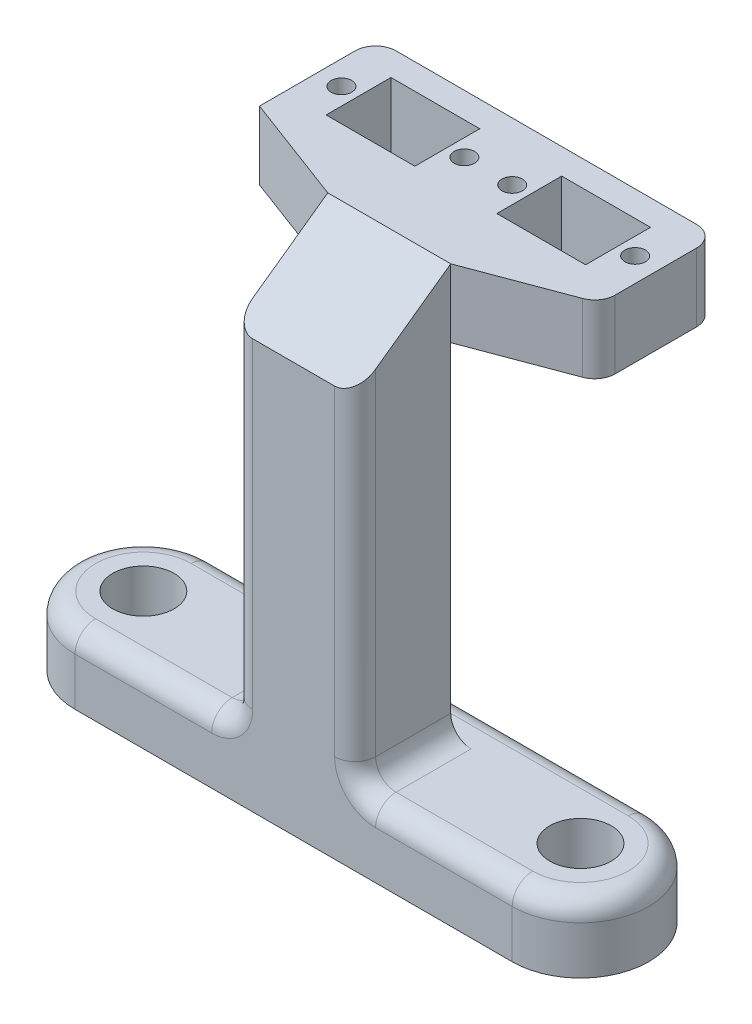
from build123d import *

# Parameters (mm, degrees)
SKETCH1_R           = 4.5
BOSS_EXTRUDE1_DEPTH = 10
SKETCH2_W           = 18
SKETCH2_H           = 14
BOSS_EXTRUDE2_DEPTH = 50
SKETCH4_R           = 1.5
SKETCH4_W           = 13
SKETCH4_H           = 9.5
BOSS_EXTRUDE3_DEPTH = 10
LOFT2_START         = -9
LOFT2_DEPTH         = 18
FILLET4_R           = 3


# Read off the part's stored shape, not the designer's step: Loft2
with BuildPart() as part:
    # Sketch1 → Boss-Extrude1 (new body)
    with BuildSketch(Plane(origin=(0, 0, 0), x_dir=(1, 0, 0), z_dir=(0, 1, 0))):
        with BuildLine():
            Line((-32, 10), (32, 10))
            ThreePointArc((32, 10), (42, 0), (32, -10))
            Line((32, -10), (-32, -10))
            ThreePointArc((-32, -10), (-42, 0), (-32, 10))
        make_face()
        with Locations(Location((-32, 0, 0), (0, 0, 270))):
            Circle(SKETCH1_R, mode=Mode.SUBTRACT)
        with Locations(Location((32, 0, 0), (0, 0, 270))):
            Circle(SKETCH1_R, mode=Mode.SUBTRACT)
    extrude(amount=BOSS_EXTRUDE1_DEPTH)

    # Sketch2 → Boss-Extrude2 (add)
    with BuildSketch(Plane(origin=(0, 10, 0), x_dir=(1, 0, 0), z_dir=(0, 1, 0))):
        with Locations((0, -3)):
            Rectangle(SKETCH2_W, SKETCH2_H)
    extrude(amount=BOSS_EXTRUDE2_DEPTH)



with BuildPart() as body_2:
    # Sketch4 → Boss-Extrude3 (new body)
    with BuildSketch(Plane(origin=(0, 60, 0), x_dir=(1, 0, 0), z_dir=(0, 1, 0))):
        Polygon((-25, 10), (-25, 27), (0, 27), (25, 27), (25, 10), (9, 4), (-9, 4), align=None)
        with Locations(Location((-21.5, 18.5, 0), (0, 0, 270))):
            Circle(SKETCH4_R, mode=Mode.SUBTRACT)
        with Locations(Location((-3.5, 18.5, 0), (0, 0, 270))):
            Circle(SKETCH4_R, mode=Mode.SUBTRACT)
        with Locations(Location((3.5, 18.5, 0), (0, 0, 90))):
            Circle(SKETCH4_R, mode=Mode.SUBTRACT)
        with Locations(Location((21.5, 18.5, 0), (0, 0, 90))):
            Circle(SKETCH4_R, mode=Mode.SUBTRACT)
        with Locations((-12.5, 18.5)):
            Rectangle(SKETCH4_W, SKETCH4_H, mode=Mode.SUBTRACT)
        with Locations((12.5, 18.5)):
            Rectangle(SKETCH4_W, SKETCH4_H, mode=Mode.SUBTRACT)
    extrude(amount=BOSS_EXTRUDE3_DEPTH)


with BuildPart() as part_1:
    add(part.part)

    add(body_2.part)  # Loft2 merges body 2
    # Loft2 outline → Loft2 (add)
    with BuildSketch(Plane.YZ.offset(LOFT2_START)):
        Polygon((60, -4), (70, -4), (60, 10), align=None)
    extrude(amount=LOFT2_DEPTH)

    # Fillet4
    fillet4_edges = [part_1.edges().sort_by_distance(p)[0] for p in [
        (0, 10, -10),
        (-42, 10, 0),
        (42, 10, 0),
        (9, 35, 10),
        (9, 10, 3),
        (-9, 10, 3),
        (20.5, 10, 10),
        (-20.5, 10, 10),
        (25, 65, -10),
        (25, 65, -27),
        (-25, 65, -27),
        (-9, 35, 10),
    ]]
    fillet(fillet4_edges, radius=FILLET4_R)


solid = part_1.part
